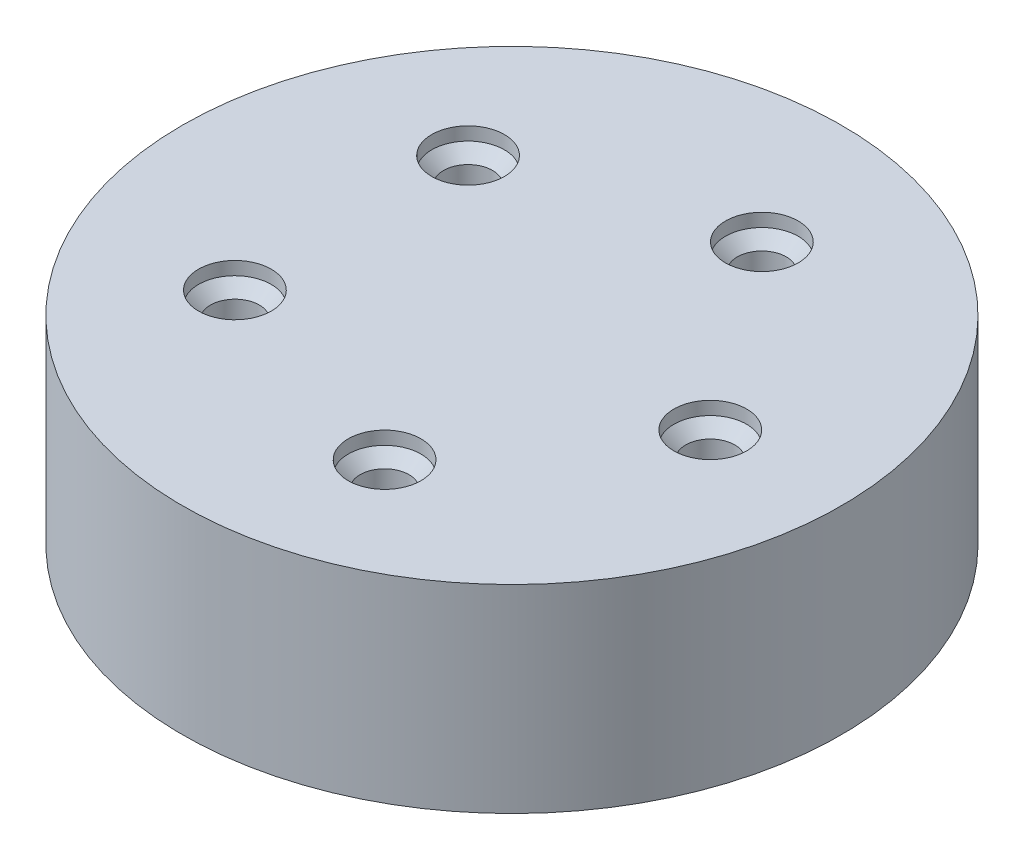
from build123d import *

# Parameters (mm, degrees)
BOSS_EXTRUDE1_DEPTH                            = 5
BOSS_EXTRUDE1_DEPTH_BACK                       = 10
SKETCH3_R                                      = 24.925
SKETCH3_R_2                                    = 1.85
CSK_FOR_M2_5_FLAT_HEAD_MACHINE_SCREW1_AT_COUNT = 2
CSK_FOR_M2_5_FLAT_HEAD_MACHINE_SCREW1_AT_PITCH = 17.633557569
CSK_FOR_M2_5_FLAT_HEAD_MACHINE_SCREW_2_COUNT   = 2
CSK_FOR_M2_5_FLAT_HEAD_MACHINE_SCREW_2_PITCH   = 28.531695489
CSK_FOR_M2_5_FLAT_HEAD_MACHINE_SCREW_3_COUNT   = 2
CSK_FOR_M2_5_FLAT_HEAD_MACHINE_SCREW_3_PITCH   = 28.531695489
CSK_FOR_M2_5_FLAT_HEAD_MACHINE_SCREW_4_COUNT   = 2
CSK_FOR_M2_5_FLAT_HEAD_MACHINE_SCREW_4_PITCH   = 17.633557569


with BuildPart() as part:
    # Sketch3 → Boss-Extrude1 (new, two sides: drawn at the far end of the back side and taken through both)
    with BuildSketch(Plane(origin=(0, 15, 0), x_dir=(1, 0, 0), z_dir=(0, 1, 0)).offset(-BOSS_EXTRUDE1_DEPTH_BACK)):
        with Locations((-1.2, 0)):
            Circle(SKETCH3_R)
        with Locations((13.8, 0)):
            Circle(SKETCH3_R_2, mode=Mode.SUBTRACT)
        with Locations((3.435254916, 14.265847744)):
            Circle(SKETCH3_R_2, mode=Mode.SUBTRACT)
        with Locations((-13.335254916, 8.816778784)):
            Circle(SKETCH3_R_2, mode=Mode.SUBTRACT)
        with Locations((-13.335254916, -8.816778784)):
            Circle(SKETCH3_R_2, mode=Mode.SUBTRACT)
        with Locations((3.435254916, -14.265847744)):
            Circle(SKETCH3_R_2, mode=Mode.SUBTRACT)
    extrude(amount=BOSS_EXTRUDE1_DEPTH + BOSS_EXTRUDE1_DEPTH_BACK)

    # Sketch5 → CSK for M2.5 Flat Head Machine Screw1 (revolve, cut)
    with BuildSketch(Plane(origin=(3.435254916, 20, -14.265847744), x_dir=(0, 0, 1), z_dir=(1, 0, 0))):
        Polygon((0, 0), (0, 15), (1.45, 15), (1.45, 2.3), (2.75, 1), (2.75, 0), align=None)
    csk_for_m2_5_flat_head_machine_screw1 = revolve(axis=Axis((3.435254916, 26.35, -14.265847744), (0, -1, 0)), mode=Mode.SUBTRACT)

    # CSK for M2.5 Flat Head Machine Screw1 at: CSK for M2.5 Flat Head Machine Screw1 ×2
    with Locations(*[Vector(0.5877852522924684, 0, 0.809016994374951) * (i * CSK_FOR_M2_5_FLAT_HEAD_MACHINE_SCREW1_AT_PITCH) for i in range(1, CSK_FOR_M2_5_FLAT_HEAD_MACHINE_SCREW1_AT_COUNT)]):
        add(csk_for_m2_5_flat_head_machine_screw1, mode=Mode.SUBTRACT)

    # CSK for M2.5 Flat Head Machine Screw 2: CSK for M2.5 Flat Head Machine Screw1 ×2
    with Locations(*[(0, 0, i * CSK_FOR_M2_5_FLAT_HEAD_MACHINE_SCREW_2_PITCH) for i in range(1, CSK_FOR_M2_5_FLAT_HEAD_MACHINE_SCREW_2_COUNT)]):
        add(csk_for_m2_5_flat_head_machine_screw1, mode=Mode.SUBTRACT)

    # CSK for M2.5 Flat Head Machine Screw 3: CSK for M2.5 Flat Head Machine Screw1 ×2
    with Locations(*[Vector(-0.5877852522924802, 0, 0.8090169943749422) * (i * CSK_FOR_M2_5_FLAT_HEAD_MACHINE_SCREW_3_PITCH) for i in range(1, CSK_FOR_M2_5_FLAT_HEAD_MACHINE_SCREW_3_COUNT)]):
        add(csk_for_m2_5_flat_head_machine_screw1, mode=Mode.SUBTRACT)

    # CSK for M2.5 Flat Head Machine Screw 4: CSK for M2.5 Flat Head Machine Screw1 ×2
    with Locations(*[Vector(-0.9510565162951568, 0, 0.3090169943749378) * (i * CSK_FOR_M2_5_FLAT_HEAD_MACHINE_SCREW_4_PITCH) for i in range(1, CSK_FOR_M2_5_FLAT_HEAD_MACHINE_SCREW_4_COUNT)]):
        add(csk_for_m2_5_flat_head_machine_screw1, mode=Mode.SUBTRACT)


solid = part.part
